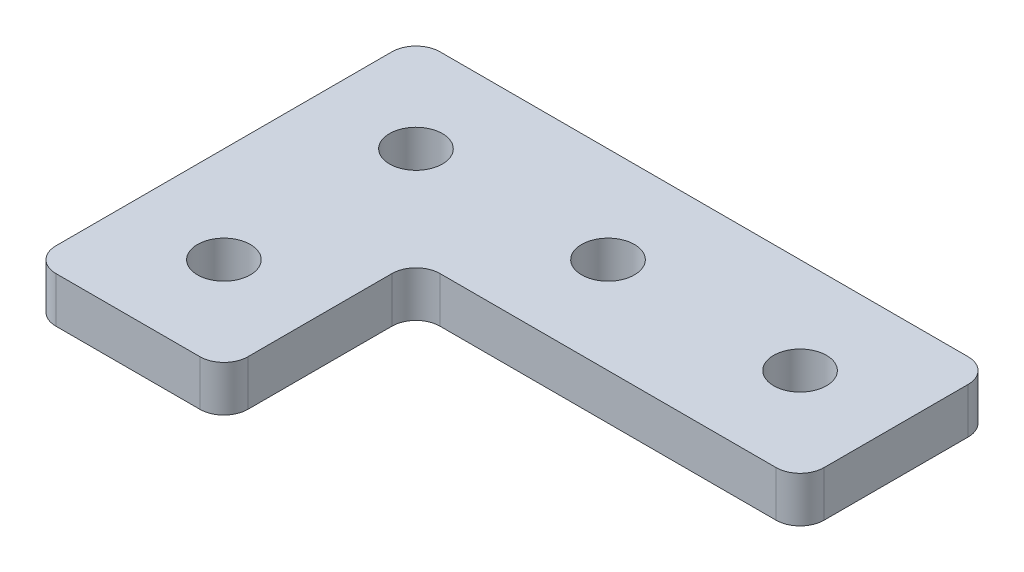
from build123d import *

# Parameters (mm, degrees)
SKETCH1_R           = 2.75
BOSS_EXTRUDE1_DEPTH = 2.3749


with BuildPart() as part:
    # Sketch1 → Boss-Extrude1 (new, symmetric)
    with BuildSketch(Plane(origin=(0, 0, 0), x_dir=(1, 0, 0), z_dir=(0, 1, 0))):
        with BuildLine():
            Line((-10, 7.5), (-10, -27.5))
            ThreePointArc((-10, -27.5), (-9.267766953, -29.267766953), (-7.5, -30))
            Line((-7.5, -30), (7.5, -30))
            ThreePointArc((7.5, -30), (9.267766953, -29.267766953), (10, -27.5))
            Line((10, -27.5), (10, -12.5))
            ThreePointArc((10, -12.5), (10.732233047, -10.732233047), (12.5, -10))
            Line((12.5, -10), (47.5, -10))
            ThreePointArc((47.5, -10), (49.267766953, -9.267766953), (50, -7.5))
            Line((50, -7.5), (50, 7.5))
            ThreePointArc((50, 7.5), (49.267766953, 9.267766953), (47.5, 10))
            Line((47.5, 10), (-7.5, 10))
            ThreePointArc((-7.5, 10), (-9.267766953, 9.267766953), (-10, 7.5))
        make_face()
        Circle(SKETCH1_R, mode=Mode.SUBTRACT)
        with Locations((20, 0)):
            Circle(SKETCH1_R, mode=Mode.SUBTRACT)
        with Locations((40, 0)):
            Circle(SKETCH1_R, mode=Mode.SUBTRACT)
        with Locations((0, -20)):
            Circle(SKETCH1_R, mode=Mode.SUBTRACT)
    extrude(amount=BOSS_EXTRUDE1_DEPTH, both=True)


solid = part.part
